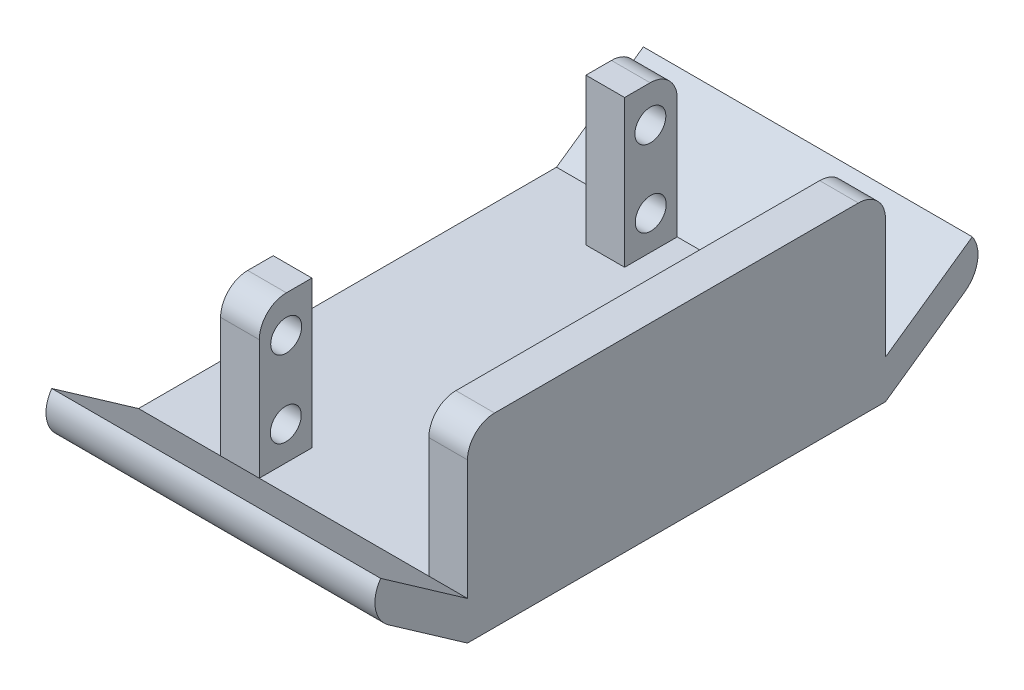
from build123d import *

# Parameters (mm, degrees)
SKETCH_OF_SERVO_MOTOR_W             = 42.5
SKETCH_OF_SERVO_MOTOR_H             = 54
EXTRUDE_BASE_OF_FOOT_DEPTH          = 5
POSITIONS_OF_FOOT_SIDES_W           = 5
POSITIONS_OF_FOOT_SIDES_H           = 54
POSITIONS_OF_FOOT_SIDES_H_2         = 6.8
EXTRUDE_SIDES_OF_FOOT_DEPTH         = 19
FILLET_TOP_EDGES_OF_SIDES_OF_FOOT_R = 3.5
EXTRUDE_FOOT_LIPS_DEPTH             = 42.5
FILLET_FOOT_LIPS_R                  = 4.1
HOLE_DIMENSIONS_FOR_M4_BOLT_R       = 2
EXTRUDE_CUT_HOLE_FOR_M4_BOLT_DEPTH  = 5


with BuildPart() as part:
    # Sketch of Servo Motor → Extrude Base of Foot (new body)
    with BuildSketch(Plane(origin=(0, 0, 0), x_dir=(1, 0, 0), z_dir=(0, 1, 0))):
        with Locations((10.65, -20.2)):
            Rectangle(SKETCH_OF_SERVO_MOTOR_W, SKETCH_OF_SERVO_MOTOR_H)
    extrude(amount=-EXTRUDE_BASE_OF_FOOT_DEPTH)

    # Positions of Foot Sides → Extrude Sides of Foot (add)
    with BuildSketch(Plane(origin=(0, 0, 0), x_dir=(1, 0, 0), z_dir=(0, 1, 0))):
        with Locations((29.4, -20.2)):
            Rectangle(POSITIONS_OF_FOOT_SIDES_W, POSITIONS_OF_FOOT_SIDES_H)
        with Locations((2.5, 3.4)):
            Rectangle(POSITIONS_OF_FOOT_SIDES_W, POSITIONS_OF_FOOT_SIDES_H_2)
        with Locations((2.5, -43.8)):
            Rectangle(POSITIONS_OF_FOOT_SIDES_W, POSITIONS_OF_FOOT_SIDES_H_2)
    extrude(amount=EXTRUDE_SIDES_OF_FOOT_DEPTH)

    # Fillet Top Edges of Sides of Foot
    fillet_top_edges_of_sides_of_foot_edges = [part.edges().sort_by_distance(p)[0] for p in [
        (2.5, 19, -6.8),
        (2.5, 19, 47.2),
        (29.4, 19, -6.8),
        (29.4, 19, 47.2),
    ]]
    fillet(fillet_top_edges_of_sides_of_foot_edges, radius=FILLET_TOP_EDGES_OF_SIDES_OF_FOOT_R)

    # Front and Back Foot Lips → Extrude Foot Lips (add, through all)
    with BuildSketch(Plane.ZY.offset(10.6)):
        Polygon((60.767406064, 4.5), (58.418174512, 7.855050358), (47.2, 0), (47.2, -5), align=None)
        Polygon((-6.8, 0), (-6.8, -5), (-20.367406064, 4.5), (-18.018174512, 7.855050358), align=None)
    extrude(amount=-EXTRUDE_FOOT_LIPS_DEPTH)

    # Fillet Foot Lips
    # the kernel refuses this fillet: 4.1 mm, written as the material it takes off along each edge
    with BuildSketch(Plane(origin=(-20.85, 4.5, 60.767406064), x_dir=(0, 0.8191520442889908, -0.5735764363510476), z_dir=(1, 0, 0)), Plane(origin=(-20.85, 4.5, -20.367406064), x_dir=(0, -0.5735764363510438, 0.8191520442889934), z_dir=(1, 0, 0))) as fillet_foot_lips_piece_1:
        with BuildLine():
            CenterArc((FILLET_FOOT_LIPS_R, -FILLET_FOOT_LIPS_R), FILLET_FOOT_LIPS_R, 90, 90)
            Line((0, -FILLET_FOOT_LIPS_R), (0, 0))
            Line((0, 0), (FILLET_FOOT_LIPS_R, 0))
        make_face()
    extrude(amount=63, mode=Mode.SUBTRACT)

    # Hole Dimensions for M4 Bolt → Extrude Cut Hole for M4 Bolt (cut)
    with BuildSketch(Plane.ZY):
        with Locations((-3.324953132, 14.258904835)):
            Circle(HOLE_DIMENSIONS_FOR_M4_BOLT_R)
        with Locations((-3.377058396, 4.358904835)):
            Circle(HOLE_DIMENSIONS_FOR_M4_BOLT_R)
        with Locations((43.724953132, 14.258904835)):
            Circle(HOLE_DIMENSIONS_FOR_M4_BOLT_R)
        with Locations((43.777058396, 4.358904835)):
            Circle(HOLE_DIMENSIONS_FOR_M4_BOLT_R)
    extrude(amount=-EXTRUDE_CUT_HOLE_FOR_M4_BOLT_DEPTH, mode=Mode.SUBTRACT)


solid = part.part
